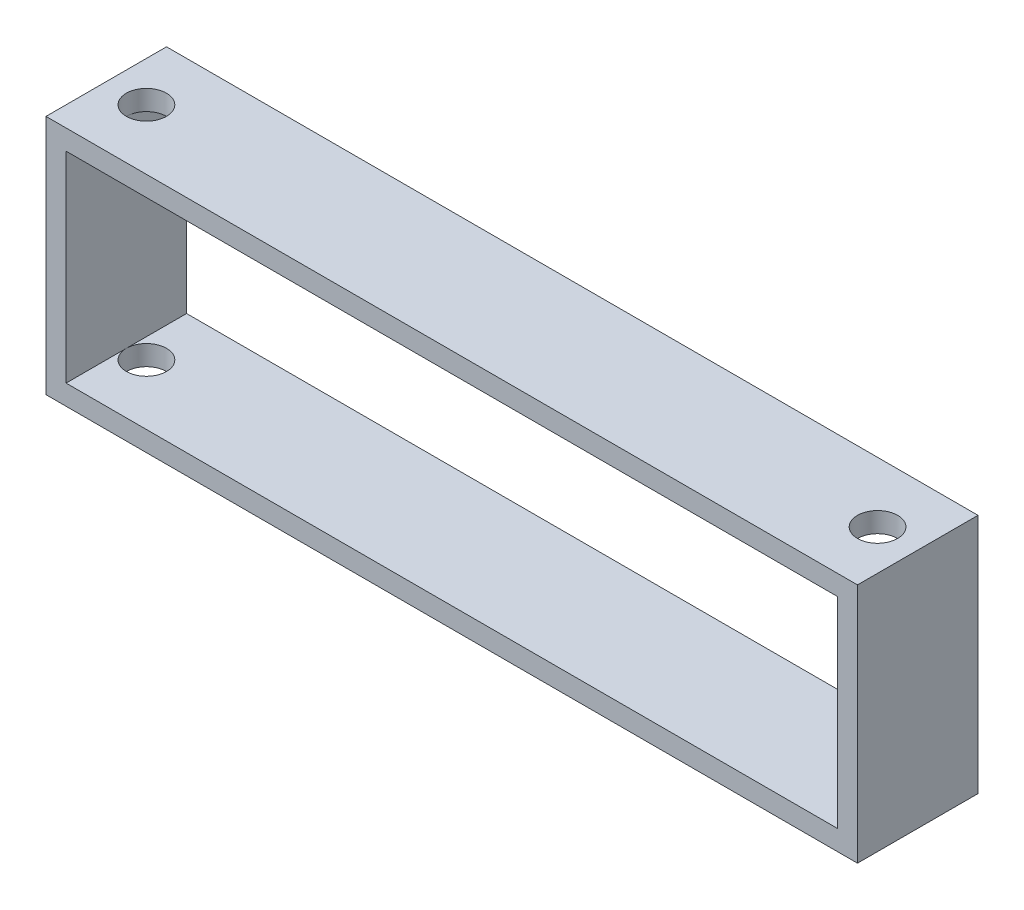
from build123d import *

# Parameters (mm, degrees)
CROQUIS1_W              = 202
CROQUIS1_H              = 30
CROQUIS1_R              = 5
SALIENTE_EXTRUIR1_DEPTH = 60
CROQUIS2_W              = 192
CROQUIS2_H              = 50
CORTAR_EXTRUIR1_DEPTH   = 169.836501235


with BuildPart() as part:
    # Croquis1 → Saliente-Extruir1 (new body)
    with BuildSketch(Plane(origin=(0, 0, 0), x_dir=(1, 0, 0), z_dir=(0, 1, 0))):
        with Locations((53.937936443, 4.098360656)):
            Rectangle(CROQUIS1_W, CROQUIS1_H)
        with Locations((-37.062063557, 4.098360656)):
            Circle(CROQUIS1_R, mode=Mode.SUBTRACT)
        with Locations((144.937936443, 4.098360656)):
            Circle(CROQUIS1_R, mode=Mode.SUBTRACT)
    extrude(amount=SALIENTE_EXTRUIR1_DEPTH)

    # Croquis2 → Cortar-Extruir1 (cut, through all)
    with BuildSketch(Plane.XY.offset(10.901639344)):
        with Locations((53.937936443, 30)):
            Rectangle(CROQUIS2_W, CROQUIS2_H)
    extrude(amount=-CORTAR_EXTRUIR1_DEPTH, mode=Mode.SUBTRACT)


solid = part.part
